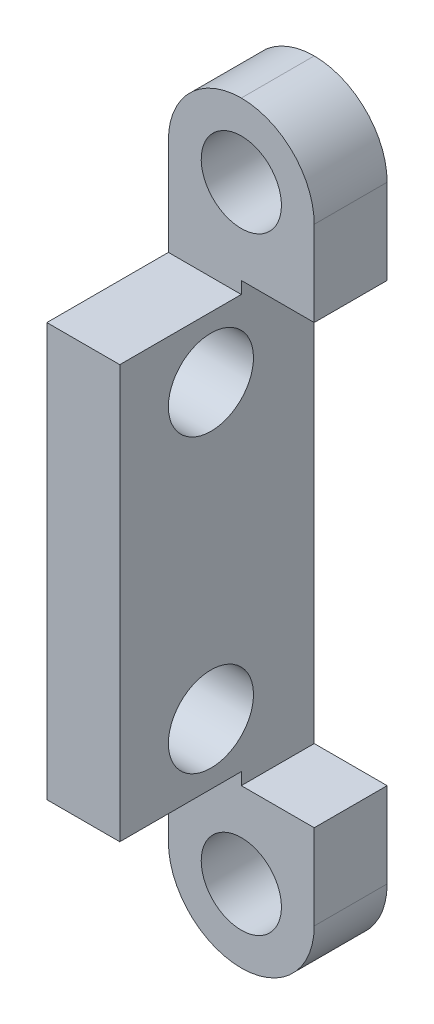
from build123d import *

# Parameters (mm, degrees)
ESQUISSE1_R             = 1.65
BOSS_EXTRU_1_DEPTH      = 8
ESQUISSE2_R             = 1.75
ENL_V_MAT_EXTRU_1_DEPTH = 33.57299495
CONG_1_R                = 3
ESQUISSE3_W             = 5
ESQUISSE3_H             = 7
ENL_V_MAT_EXTRU_2_DEPTH = 33.57299495


with BuildPart() as part:
    # Esquisse1 → Boss.-Extru.1 (new body)
    with BuildSketch(Plane.XY):
        Polygon((0, 0), (6, 0), (6, 6.5), (3, 6.5), (3, 24.5), (6, 24.5), (6, 31), (0, 31), align=None)
        with Locations((3, 28)):
            Circle(ESQUISSE1_R, mode=Mode.SUBTRACT)
        with Locations(Location((3, 3, 0), (0, 0, 180))):
            Circle(ESQUISSE1_R, mode=Mode.SUBTRACT)
    extrude(amount=BOSS_EXTRU_1_DEPTH)

    # Esquisse2 → Enlèv. mat.-Extru.1 (cut, through all)
    with BuildSketch(Plane.ZY):
        with Locations((4.25, 21.5)):
            Circle(ESQUISSE2_R)
        with Locations((4.25, 9.5)):
            Circle(ESQUISSE2_R)
    extrude(amount=-ENL_V_MAT_EXTRU_1_DEPTH, mode=Mode.SUBTRACT)

    # Congé1
    cong_1_edges = [part.edges().sort_by_distance(p)[0] for p in [
        (6, 0, 4),
        (0, 0, 4),
        (0, 31, 4),
        (6, 31, 4),
    ]]
    fillet(cong_1_edges, radius=CONG_1_R - 0.0001)  # a hair under: the kernel refuses the full size

    # Esquisse3 → Enlèv. mat.-Extru.2 (cut, through all)
    with BuildSketch(Plane.ZY):
        with Locations((5.5, 27.5)):
            Rectangle(ESQUISSE3_W, ESQUISSE3_H)
        with Locations((5.5, 3.5)):
            Rectangle(ESQUISSE3_W, ESQUISSE3_H)
    extrude(amount=-ENL_V_MAT_EXTRU_2_DEPTH, mode=Mode.SUBTRACT)


solid = part.part
